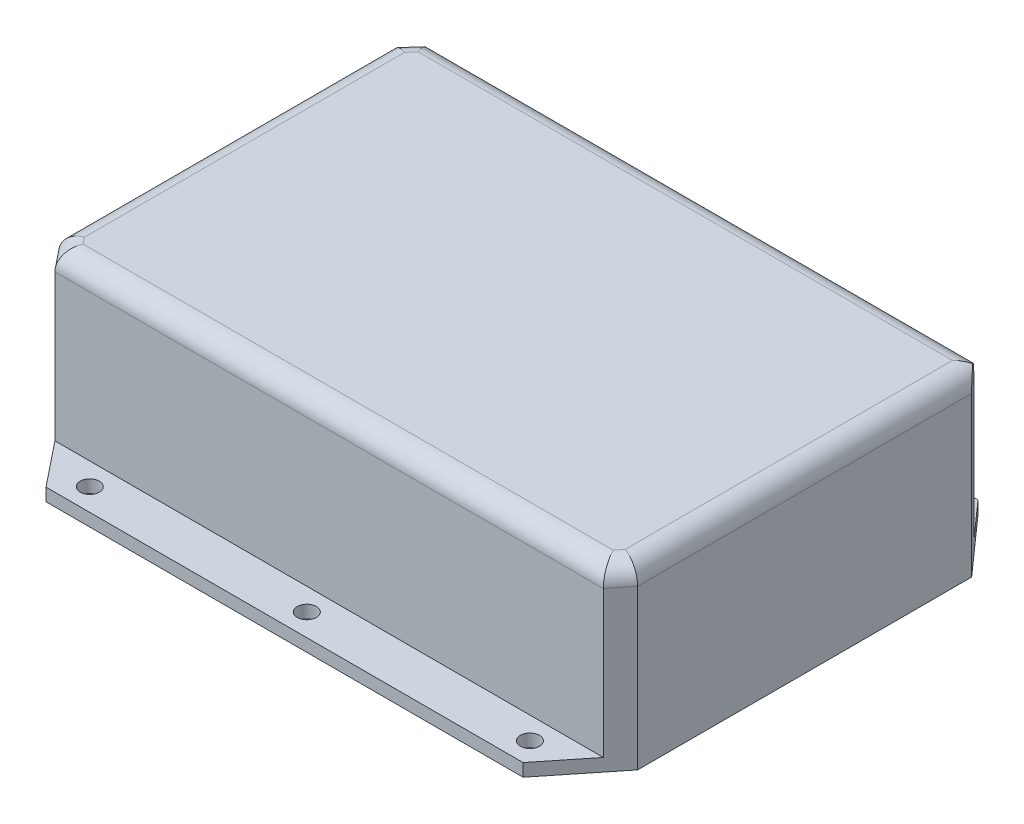
from build123d import *

# Parameters (mm, degrees)
SKETCH_1_R          = 3
EXTRUDE_3_DEPTH     = 4
EXTRUDE_5_DEPTH     = 52
SKETCH_4_W          = 170
SKETCH_4_H          = 105
CUT_EXTRUDE_1_DEPTH = 52
FILLET_1_R          = 6
CUT_EXTRUDE_2_REACH = 205.755


with BuildPart() as part:
    # 草图1 → 凸台-拉伸3 (new body)
    with BuildSketch(Plane(origin=(0, 0, 0), x_dir=(1, 0, 0), z_dir=(0, 1, 0))):
        Polygon((-75, 70.5), (75, 70.5), (91, 52.5), (91, -52.5), (75, -72.5), (-75, -72.5), (-91, -52.5), (-91, 52.5), align=None)
        with Locations(Location((0, 64.5, 0), (0, 0, 270))):
            Circle(SKETCH_1_R, mode=Mode.SUBTRACT)
        with Locations(Location((-68.230807573, 64.5, 0), (0, 0, 270))):
            Circle(SKETCH_1_R, mode=Mode.SUBTRACT)
        with Locations(Location((70.140932989, 64.5, 0), (0, 0, 270))):
            Circle(SKETCH_1_R, mode=Mode.SUBTRACT)
        with Locations(Location((0, -65.5, 0), (0, 0, 270))):
            Circle(SKETCH_1_R, mode=Mode.SUBTRACT)
        with Locations(Location((70.140932989, -65.5, 0), (0, 0, 270))):
            Circle(SKETCH_1_R, mode=Mode.SUBTRACT)
        with Locations(Location((-68.230807573, -65.5, 0), (0, 0, 270))):
            Circle(SKETCH_1_R, mode=Mode.SUBTRACT)
    extrude(amount=EXTRUDE_3_DEPTH)

    # 草图3 → 凸台-拉伸5 (add)
    with BuildSketch(Plane(origin=(0, 4, 0), x_dir=(1, 0, 0), z_dir=(0, 1, 0))):
        Polygon((-91, 52.5), (-91, -52.5), (-86.2, -58.5), (86.2, -58.5), (91, -52.5), (91, 52.5), (85.666666667, 58.5), (-85.666666667, 58.5), align=None)
    extrude(amount=EXTRUDE_5_DEPTH)

    # 草图4 → 切除-拉伸1 (cut)
    with BuildSketch(Plane.XZ):
        Rectangle(SKETCH_4_W, SKETCH_4_H)
    extrude(amount=-CUT_EXTRUDE_1_DEPTH, mode=Mode.SUBTRACT)

    # 圆角1
    # the kernel refuses this fillet: 6 mm, written as the material it takes off along each edge
    with BuildSketch(Plane(origin=(-100.370425713, 56, 40.786967858), x_dir=(0.7808688094430221, 0, -0.6246950475544346), z_dir=(0.6246950475544346, 0, 0.7808688094430221)), Plane(origin=(76.829574287, 56, 70.213032142), x_dir=(-0.7808688094430356, 0, -0.6246950475544176), z_dir=(0.6246950475544177, 0, -0.7808688094430356))) as fillet_1_piece_1:
        with BuildLine():
            CenterArc((FILLET_1_R, -FILLET_1_R), FILLET_1_R, 90, 90)
            Line((0, -FILLET_1_R), (0, 0))
            Line((0, 0), (FILLET_1_R, 0))
        make_face()
    extrude(amount=37.683749085, mode=Mode.SUBTRACT)
    with BuildSketch(Plane(origin=(-75.701209084, 56, -69.71113978), x_dir=(0, -1, 0), z_dir=(-0.6643638388299179, 0, 0.7474093186836614))) as fillet_1_piece_2:
        with BuildLine():
            CenterArc((FILLET_1_R, FILLET_1_R), FILLET_1_R, 180, 90)
            Line((0, FILLET_1_R), (0, 0))
            Line((0, 0), (FILLET_1_R, 0))
        make_face()
    extrude(amount=38.027729719, mode=Mode.SUBTRACT)
    with BuildSketch(Plane(origin=(100.666666667, 56, -58.5), x_dir=(0, 0, 1), z_dir=(-1, 0, 0))) as fillet_1_piece_3:
        with BuildLine():
            CenterArc((FILLET_1_R, -FILLET_1_R), FILLET_1_R, 90, 90)
            Line((0, -FILLET_1_R), (0, 0))
            Line((0, 0), (FILLET_1_R, 0))
        make_face()
    extrude(amount=201.333333333, mode=Mode.SUBTRACT)
    with BuildSketch(Plane(origin=(91, 56, 67.5), x_dir=(-1, 0, 0), z_dir=(0, 0, -1))) as fillet_1_piece_4:
        with BuildLine():
            CenterArc((FILLET_1_R, -FILLET_1_R), FILLET_1_R, 90, 90)
            Line((0, -FILLET_1_R), (0, 0))
            Line((0, 0), (FILLET_1_R, 0))
        make_face()
    extrude(amount=135, mode=Mode.SUBTRACT)
    with BuildSketch(Plane(origin=(-91, 56, -67.5), x_dir=(0, -1, 0), z_dir=(0, 0, 1))) as fillet_1_piece_5:
        with BuildLine():
            CenterArc((FILLET_1_R, FILLET_1_R), FILLET_1_R, 180, 90)
            Line((0, FILLET_1_R), (0, 0))
            Line((0, 0), (FILLET_1_R, 0))
        make_face()
    extrude(amount=135, mode=Mode.SUBTRACT)
    with BuildSketch(Plane(origin=(-101.2, 56, 58.5), x_dir=(0, 0, -1), z_dir=(1, 0, 0))) as fillet_1_piece_6:
        with BuildLine():
            CenterArc((FILLET_1_R, -FILLET_1_R), FILLET_1_R, 90, 90)
            Line((0, -FILLET_1_R), (0, 0))
            Line((0, 0), (FILLET_1_R, 0))
        make_face()
    extrude(amount=202.4, mode=Mode.SUBTRACT)

    # 草图5 → 切除-拉伸2 (cut, up to next)
    with BuildSketch(Plane.ZY.offset(91), mode=Mode.PRIVATE) as cut_extrude_2_sk1:
        with BuildLine():
            Line((-25, 0), (25, 0))
            Line((25, 0), (25, 35))
            ThreePointArc((25, 35), (23.535533906, 38.535533906), (20, 40))
            Line((20, 40), (-20, 40))
            ThreePointArc((-20, 40), (-23.535533906, 38.535533906), (-25, 35))
            Line((-25, 35), (-25, 0))
        make_face()
    cut_extrude_2_tool1 = extrude(cut_extrude_2_sk1.sketch, amount=-CUT_EXTRUDE_2_REACH, mode=Mode.PRIVATE) & part.part
    add(cut_extrude_2_tool1.solids().sort_by_distance((-91, 19.898145, 0))[0], mode=Mode.SUBTRACT)


solid = part.part
